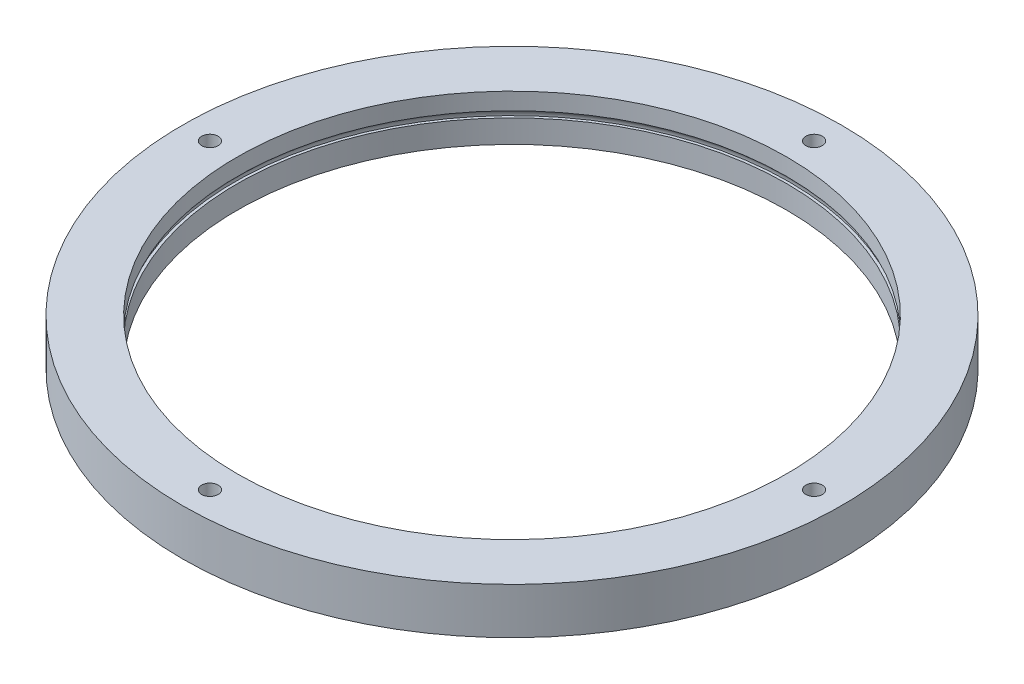
from build123d import *

# Parameters (mm, degrees)
SKETCH_1_R          = 60
SKETCH_1_R_2        = 50
EXTRUDE_2_DEPTH     = 8.4
SKETCH_5_R          = 1.5
CUT_EXTRUDE_1_DEPTH = 10


with BuildPart() as part:
    # 草图1 → 凸台-拉伸2 (new body)
    with BuildSketch(Plane(origin=(0, 0, 0), x_dir=(1, 0, 0), z_dir=(0, 1, 0))):
        Circle(SKETCH_1_R)
        Circle(SKETCH_1_R_2, mode=Mode.SUBTRACT)
    extrude(amount=EXTRUDE_2_DEPTH)

    # 草图4 → 切除-旋转1 (revolve, cut)
    with BuildSketch(Plane.XY):
        with BuildLine():
            ThreePointArc((-50, 5.302978388), (-50.369306394, 4.797316835), (-50.5, 4.184944399))
            Line((-50.5, 4.184944399), (0, 4.184944399))
            Line((0, 4.184944399), (0, 5.302978388))
            Line((0, 5.302978388), (-50, 5.302978388))
        make_face()
    revolve(axis=Axis((0, 5.302978388, 0), (0, -1, 0)), mode=Mode.SUBTRACT)

    # 草图5 → 切除-拉伸1 (cut)
    with BuildSketch(Plane(origin=(0, 8.4, 0), x_dir=(1, 0, 0), z_dir=(0, 1, 0))):
        with Locations((0, 55)):
            Circle(SKETCH_5_R)
        with Locations((55, 0)):
            Circle(SKETCH_5_R)
        with Locations((-55, 0)):
            Circle(SKETCH_5_R)
        with Locations((0, -55)):
            Circle(SKETCH_5_R)
    extrude(amount=-CUT_EXTRUDE_1_DEPTH, mode=Mode.SUBTRACT)


solid = part.part
